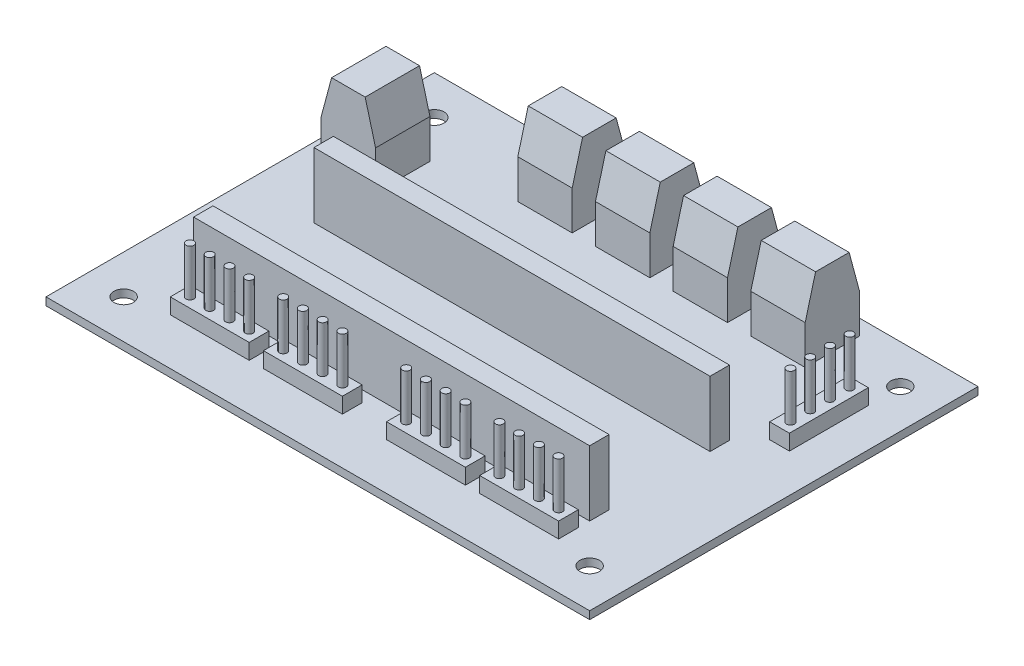
from build123d import *
from OCP.BRepFilletAPI import BRepFilletAPI_MakeChamfer

# Parameters (mm, degrees)
SKETCH_2_W      = 70
SKETCH_2_H      = 50
SKETCH_2_R      = 1.25
EXTRUDE_1_DEPTH = 1
SKETCH_3_W      = 51
SKETCH_3_H      = 2.5
EXTRUDE_2_DEPTH = 8.4
SKETCH_4_W      = 10.16
SKETCH_4_H      = 2.54
SKETCH_4_W_2    = 2.54
SKETCH_4_H_2    = 10.16
EXTRUDE_3_DEPTH = 2
SKETCH_5_R      = 0.5
EXTRUDE_4_DEPTH = 6
SKETCH_6_W      = 7
SKETCH_6_H      = 7
EXTRUDE_5_DEPTH = 10
CHAMFER_1_SIZE  = 5
CHAMFER_1_SIZE2 = 1.339745962


with BuildPart() as part:
    # Эскиз2 → Бобышка-Вытянуть1 (new body)
    with BuildSketch(Plane(origin=(0, 0, 0), x_dir=(1, 0, 0), z_dir=(0, 1, 0))):
        with Locations((35, 25)):
            Rectangle(SKETCH_2_W, SKETCH_2_H)
        with Locations((5, 45)):
            Circle(SKETCH_2_R, mode=Mode.SUBTRACT)
        with Locations((65, 45)):
            Circle(SKETCH_2_R, mode=Mode.SUBTRACT)
        with Locations((65, 5)):
            Circle(SKETCH_2_R, mode=Mode.SUBTRACT)
        with Locations((5, 5)):
            Circle(SKETCH_2_R, mode=Mode.SUBTRACT)
    extrude(amount=EXTRUDE_1_DEPTH)

    # Эскиз3 → Бобышка-Вытянуть2 (add)
    with BuildSketch(Plane(origin=(0, 1, 0), x_dir=(1, 0, 0), z_dir=(0, 1, 0))):
        with Locations((34.5, 11.25)):
            Rectangle(SKETCH_3_W, SKETCH_3_H)
        with Locations((34.5, 26.75)):
            Rectangle(SKETCH_3_W, SKETCH_3_H)
    extrude(amount=EXTRUDE_2_DEPTH)

    # Эскиз4 → Бобышка-Вытянуть3 (add)
    with BuildSketch(Plane(origin=(0, 1, 0), x_dir=(1, 0, 0), z_dir=(0, 1, 0))):
        with Locations((54.92, 7.27)):
            Rectangle(SKETCH_4_W, SKETCH_4_H)
        with Locations((42.92, 7.27)):
            Rectangle(SKETCH_4_W, SKETCH_4_H)
        with Locations((15.08, 7.27)):
            Rectangle(SKETCH_4_W, SKETCH_4_H)
        with Locations((27.08, 7.27)):
            Rectangle(SKETCH_4_W, SKETCH_4_H)
        with Locations((63.788548428, 35.737717345)):
            Rectangle(SKETCH_4_W_2, SKETCH_4_H_2)
    extrude(amount=EXTRUDE_3_DEPTH)

    # Эскиз5 → Бобышка-Вытянуть4 (add)
    with BuildSketch(Plane(origin=(0, 3, 0), x_dir=(1, 0, 0), z_dir=(0, 1, 0))):
        with Locations((58.73, 7.27)):
            Circle(SKETCH_5_R)
        with Locations((56.19, 7.27)):
            Circle(SKETCH_5_R)
        with Locations((53.65, 7.27)):
            Circle(SKETCH_5_R)
        with Locations((51.11, 7.27)):
            Circle(SKETCH_5_R)
        with Locations((46.73, 7.27)):
            Circle(SKETCH_5_R)
        with Locations((44.19, 7.27)):
            Circle(SKETCH_5_R)
        with Locations((41.65, 7.27)):
            Circle(SKETCH_5_R)
        with Locations((39.11, 7.27)):
            Circle(SKETCH_5_R)
        with Locations((25.81, 7.27)):
            Circle(SKETCH_5_R)
        with Locations((11.27, 7.27)):
            Circle(SKETCH_5_R)
        with Locations((13.81, 7.27)):
            Circle(SKETCH_5_R)
        with Locations((16.35, 7.27)):
            Circle(SKETCH_5_R)
        with Locations((18.89, 7.27)):
            Circle(SKETCH_5_R)
        with Locations((23.27, 7.27)):
            Circle(SKETCH_5_R)
        with Locations((28.35, 7.27)):
            Circle(SKETCH_5_R)
        with Locations((30.89, 7.27)):
            Circle(SKETCH_5_R)
        with Locations((63.883852795, 31.973057503)):
            Circle(SKETCH_5_R)
        with Locations((63.883852795, 34.513057503)):
            Circle(SKETCH_5_R)
        with Locations((63.883852795, 37.053057503)):
            Circle(SKETCH_5_R)
        with Locations((63.883852795, 39.593057503)):
            Circle(SKETCH_5_R)
    extrude(amount=EXTRUDE_4_DEPTH)

    # Эскиз6 → Бобышка-Вытянуть5 (add)
    with BuildSketch(Plane(origin=(0, 1, 0), x_dir=(1, 0, 0), z_dir=(0, 1, 0))):
        with Locations((23.247184381, 44.500218353)):
            Rectangle(SKETCH_6_W, SKETCH_6_H)
        with Locations((6.108040928, 36.325560748)):
            Rectangle(SKETCH_6_W, SKETCH_6_H)
        with Locations((33.247184381, 44.500218353)):
            Rectangle(SKETCH_6_W, SKETCH_6_H)
        with Locations((43.247184381, 44.500218353)):
            Rectangle(SKETCH_6_W, SKETCH_6_H)
        with Locations((53.247184381, 44.500218353)):
            Rectangle(SKETCH_6_W, SKETCH_6_H)
    extrude(amount=EXTRUDE_5_DEPTH)

    # Фаска1: one chamfer whose edges measure the first distance from different faces: ONE call of the kernel's chamfer builder (chamfer() names one face for all edges)
    chamfer_1_edges_1 = [part.edges().sort_by_distance(p)[0] for p in [
        (53.247184381, 11, -48.000218353),
    ]]
    chamfer_1_side_1 = [part.faces().sort_by_distance(p)[0] for p in [
        (53.247184381, 6, -48.000218353),
    ]]
    chamfer_1_edges_2 = [part.edges().sort_by_distance(p)[0] for p in [
        (53.247184381, 11, -41.000218353),
    ]]
    chamfer_1_side_2 = [part.faces().sort_by_distance(p)[0] for p in [
        (53.247184381, 6, -41.000218353),
    ]]
    chamfer_1_edges_3 = [part.edges().sort_by_distance(p)[0] for p in [
        (43.247184381, 11, -48.000218353),
    ]]
    chamfer_1_side_3 = [part.faces().sort_by_distance(p)[0] for p in [
        (43.247184381, 6, -48.000218353),
    ]]
    chamfer_1_edges_4 = [part.edges().sort_by_distance(p)[0] for p in [
        (43.247184381, 11, -41.000218353),
    ]]
    chamfer_1_side_4 = [part.faces().sort_by_distance(p)[0] for p in [
        (43.247184381, 6, -41.000218353),
    ]]
    chamfer_1_edges_5 = [part.edges().sort_by_distance(p)[0] for p in [
        (33.247184381, 11, -41.000218353),
    ]]
    chamfer_1_side_5 = [part.faces().sort_by_distance(p)[0] for p in [
        (33.247184381, 6, -41.000218353),
    ]]
    chamfer_1_edges_6 = [part.edges().sort_by_distance(p)[0] for p in [
        (33.247184381, 11, -48.000218353),
    ]]
    chamfer_1_side_6 = [part.faces().sort_by_distance(p)[0] for p in [
        (33.247184381, 6, -48.000218353),
    ]]
    chamfer_1_edges_7 = [part.edges().sort_by_distance(p)[0] for p in [
        (23.247184381, 11, -48.000218353),
    ]]
    chamfer_1_side_7 = [part.faces().sort_by_distance(p)[0] for p in [
        (23.247184381, 6, -48.000218353),
    ]]
    chamfer_1_edges_8 = [part.edges().sort_by_distance(p)[0] for p in [
        (23.247184381, 11, -41.000218353),
    ]]
    chamfer_1_side_8 = [part.faces().sort_by_distance(p)[0] for p in [
        (23.247184381, 6, -41.000218353),
    ]]
    chamfer_1_edges_9 = [part.edges().sort_by_distance(p)[0] for p in [
        (9.608040928, 11, -36.325560748),
    ]]
    chamfer_1_side_9 = [part.faces().sort_by_distance(p)[0] for p in [
        (9.608040928, 6, -36.325560748),
    ]]
    chamfer_1_edges_10 = [part.edges().sort_by_distance(p)[0] for p in [
        (2.608040928, 11, -36.325560748),
    ]]
    chamfer_1_side_10 = [part.faces().sort_by_distance(p)[0] for p in [
        (2.608040928, 6, -36.325560748),
    ]]
    chamfer_1 = BRepFilletAPI_MakeChamfer(part.part.solid().wrapped)
    for e in chamfer_1_edges_1:
        chamfer_1.Add(CHAMFER_1_SIZE, CHAMFER_1_SIZE2, e.wrapped, chamfer_1_side_1[0].wrapped)  # the first distance lies on this face
    for e in chamfer_1_edges_2:
        chamfer_1.Add(CHAMFER_1_SIZE, CHAMFER_1_SIZE2, e.wrapped, chamfer_1_side_2[0].wrapped)  # the first distance lies on this face
    for e in chamfer_1_edges_3:
        chamfer_1.Add(CHAMFER_1_SIZE, CHAMFER_1_SIZE2, e.wrapped, chamfer_1_side_3[0].wrapped)  # the first distance lies on this face
    for e in chamfer_1_edges_4:
        chamfer_1.Add(CHAMFER_1_SIZE, CHAMFER_1_SIZE2, e.wrapped, chamfer_1_side_4[0].wrapped)  # the first distance lies on this face
    for e in chamfer_1_edges_5:
        chamfer_1.Add(CHAMFER_1_SIZE, CHAMFER_1_SIZE2, e.wrapped, chamfer_1_side_5[0].wrapped)  # the first distance lies on this face
    for e in chamfer_1_edges_6:
        chamfer_1.Add(CHAMFER_1_SIZE, CHAMFER_1_SIZE2, e.wrapped, chamfer_1_side_6[0].wrapped)  # the first distance lies on this face
    for e in chamfer_1_edges_7:
        chamfer_1.Add(CHAMFER_1_SIZE, CHAMFER_1_SIZE2, e.wrapped, chamfer_1_side_7[0].wrapped)  # the first distance lies on this face
    for e in chamfer_1_edges_8:
        chamfer_1.Add(CHAMFER_1_SIZE, CHAMFER_1_SIZE2, e.wrapped, chamfer_1_side_8[0].wrapped)  # the first distance lies on this face
    for e in chamfer_1_edges_9:
        chamfer_1.Add(CHAMFER_1_SIZE, CHAMFER_1_SIZE2, e.wrapped, chamfer_1_side_9[0].wrapped)  # the first distance lies on this face
    for e in chamfer_1_edges_10:
        chamfer_1.Add(CHAMFER_1_SIZE, CHAMFER_1_SIZE2, e.wrapped, chamfer_1_side_10[0].wrapped)  # the first distance lies on this face
    add(Compound.cast(chamfer_1.Shape()), mode=Mode.REPLACE)


solid = part.part
